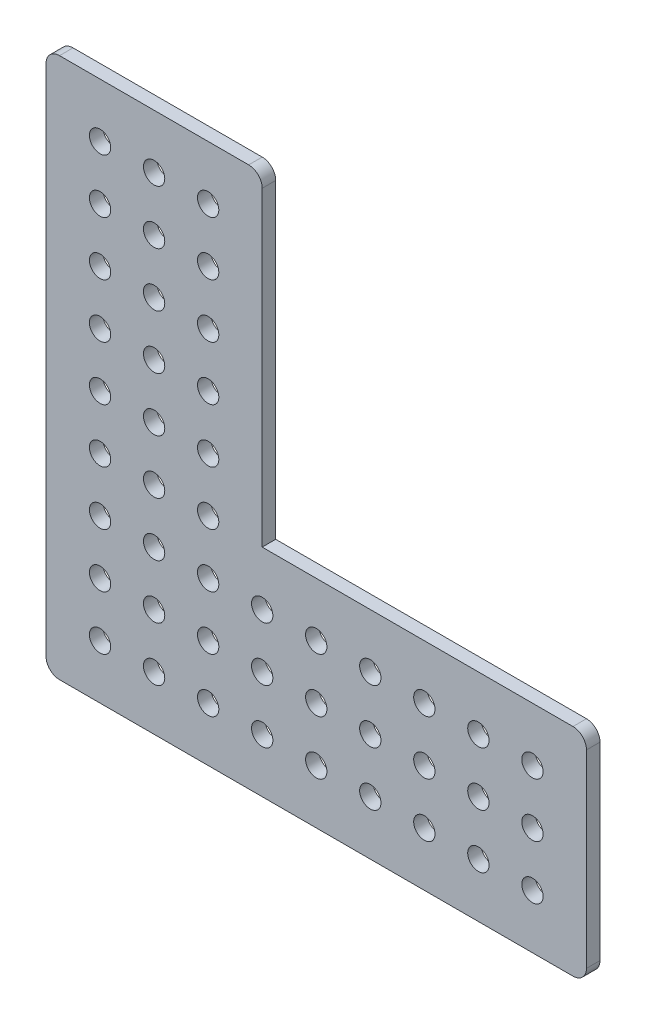
from build123d import *

# Parameters (mm, degrees)
BOSS_EXTRUDE1_DEPTH = 3.175
SKETCH2_R           = 2.505
CUT_EXTRUDE1_DEPTH  = 130.836858421


with BuildPart() as part:
    # Sketch1 → Boss-Extrude1 (new body)
    with BuildSketch(Plane.XY):
        with BuildLine():
            Line((-101.002389319, 78.348288277), (-101.002389319, -42.301711723))
            ThreePointArc((-101.002389319, -42.301711723), (-100.07245335, -44.546775753), (-97.827389319, -45.476711723))
            Line((-97.827389319, -45.476711723), (22.822610681, -45.476711723))
            ThreePointArc((22.822610681, -45.476711723), (25.067674711, -44.546775753), (25.997610681, -42.301711723))
            Line((25.997610681, -42.301711723), (25.997610681, 2.148288277))
            ThreePointArc((25.997610681, 2.148288277), (25.067674711, 4.393352307), (22.822610681, 5.323288277))
            Line((22.822610681, 5.323288277), (-50.202389319, 5.323288277))
            Line((-50.202389319, 5.323288277), (-50.202389319, 78.348288277))
            ThreePointArc((-50.202389319, 78.348288277), (-51.132325289, 80.593352307), (-53.377389319, 81.523288277))
            Line((-53.377389319, 81.523288277), (-97.827389319, 81.523288277))
            ThreePointArc((-97.827389319, 81.523288277), (-100.07245335, 80.593352307), (-101.002389319, 78.348288277))
        make_face()
    extrude(amount=BOSS_EXTRUDE1_DEPTH)

    # Sketch2 → Cut-Extrude1 (cut, through all)
    with BuildSketch(Plane.XY.offset(3.175)):
        with Locations((-88.302389319, 68.823288277)):
            Circle(SKETCH2_R)
        with Locations((13.297610681, -7.376711723)):
            Circle(SKETCH2_R)
        with Locations((-75.602389319, 68.823288277)):
            Circle(SKETCH2_R)
        with Locations((-62.902389319, 68.823288277)):
            Circle(SKETCH2_R)
        with Locations((-75.602389319, 56.123288277)):
            Circle(SKETCH2_R)
        with Locations((-62.902389319, 56.123288277)):
            Circle(SKETCH2_R)
        with Locations((-75.602389319, 43.423288277)):
            Circle(SKETCH2_R)
        with Locations((-62.902389319, 43.423288277)):
            Circle(SKETCH2_R)
        with Locations((-75.602389319, 30.723288277)):
            Circle(SKETCH2_R)
        with Locations((-62.902389319, 30.723288277)):
            Circle(SKETCH2_R)
        with Locations((-75.602389319, 18.023288277)):
            Circle(SKETCH2_R)
        with Locations((-62.902389319, 18.023288277)):
            Circle(SKETCH2_R)
        with Locations((-75.602389319, 5.323288277)):
            Circle(SKETCH2_R)
        with Locations((-62.902389319, 5.323288277)):
            Circle(SKETCH2_R)
        with Locations((-88.302389319, 56.123288277)):
            Circle(SKETCH2_R)
        with Locations((-88.302389319, 43.423288277)):
            Circle(SKETCH2_R)
        with Locations((-88.302389319, 30.723288277)):
            Circle(SKETCH2_R)
        with Locations((-88.302389319, 18.023288277)):
            Circle(SKETCH2_R)
        with Locations((-88.302389319, 5.323288277)):
            Circle(SKETCH2_R)
        with Locations((-88.302389319, -7.376711723)):
            Circle(SKETCH2_R)
        with Locations((-88.302389319, -20.076711723)):
            Circle(SKETCH2_R)
        with Locations((-88.302389319, -32.776711723)):
            Circle(SKETCH2_R)
        with Locations((0.597610681, -7.376711723)):
            Circle(SKETCH2_R)
        with Locations((-12.102389319, -7.376711723)):
            Circle(SKETCH2_R)
        with Locations((-24.802389319, -7.376711723)):
            Circle(SKETCH2_R)
        with Locations((-37.502389319, -7.376711723)):
            Circle(SKETCH2_R)
        with Locations((-50.202389319, -7.376711723)):
            Circle(SKETCH2_R)
        with Locations((-62.902389319, -7.376711723)):
            Circle(SKETCH2_R)
        with Locations((-75.602389319, -7.376711723)):
            Circle(SKETCH2_R)
        with Locations((0.597610681, -20.076711723)):
            Circle(SKETCH2_R)
        with Locations((-12.102389319, -20.076711723)):
            Circle(SKETCH2_R)
        with Locations((-24.802389319, -20.076711723)):
            Circle(SKETCH2_R)
        with Locations((-37.502389319, -20.076711723)):
            Circle(SKETCH2_R)
        with Locations((-50.202389319, -20.076711723)):
            Circle(SKETCH2_R)
        with Locations((-62.902389319, -20.076711723)):
            Circle(SKETCH2_R)
        with Locations((-75.602389319, -20.076711723)):
            Circle(SKETCH2_R)
        with Locations((0.597610681, -32.776711723)):
            Circle(SKETCH2_R)
        with Locations((-12.102389319, -32.776711723)):
            Circle(SKETCH2_R)
        with Locations((-24.802389319, -32.776711723)):
            Circle(SKETCH2_R)
        with Locations((-37.502389319, -32.776711723)):
            Circle(SKETCH2_R)
        with Locations((-50.202389319, -32.776711723)):
            Circle(SKETCH2_R)
        with Locations((-62.902389319, -32.776711723)):
            Circle(SKETCH2_R)
        with Locations((-75.602389319, -32.776711723)):
            Circle(SKETCH2_R)
        with Locations((13.297610681, -20.076711723)):
            Circle(SKETCH2_R)
        with Locations((13.297610681, -32.776711723)):
            Circle(SKETCH2_R)
    extrude(amount=-CUT_EXTRUDE1_DEPTH, mode=Mode.SUBTRACT)


solid = part.part
